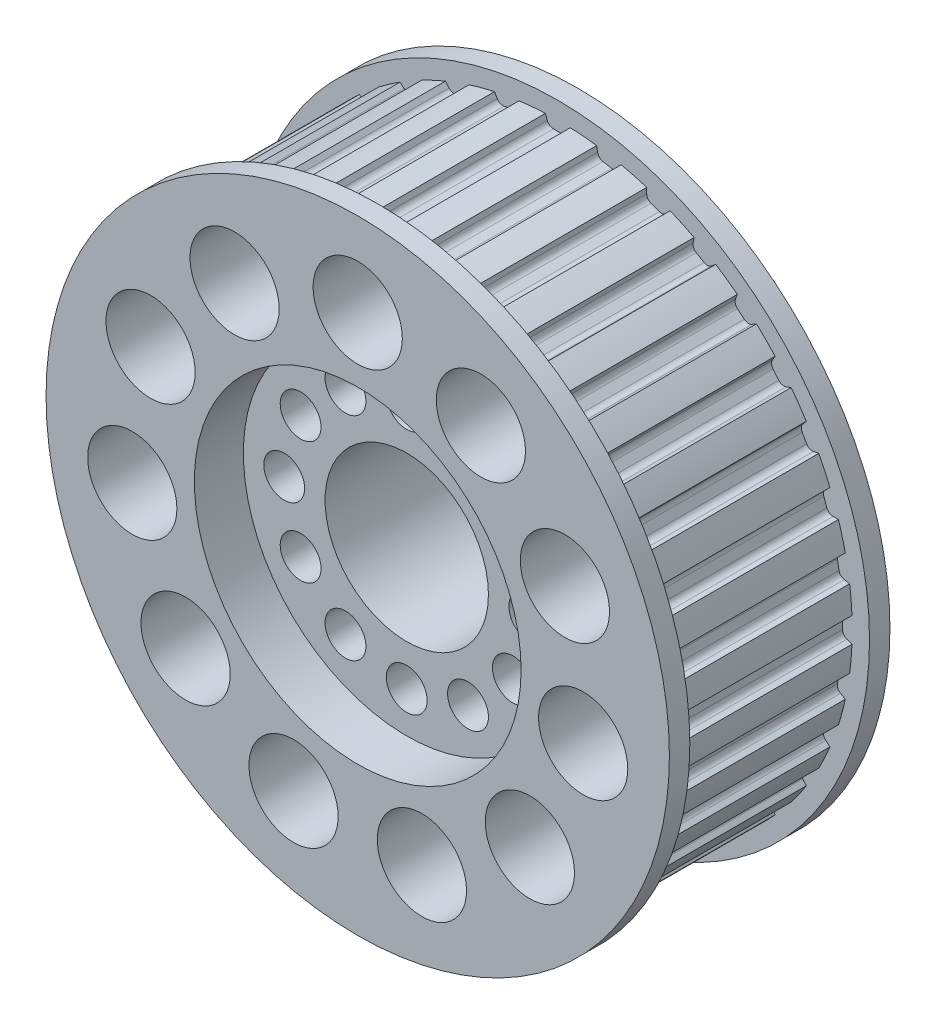
from build123d import *

# Parameters (mm, degrees)
SKETCH1_R                = 72.065639982
BASE_EXTRUDE_DEPTH       = 25
CUT_EXTRUDE1_DEPTH       = 105.937662123
FILLET1_R                = 1.6
CIRPATTERN1_COUNT        = 36
FILLET1_OF_CIRPATTERN1_R = 1.6
SKETCH7_R                = 40
CUT_EXTRUDE4_DEPTH       = 10
SKETCH12_R               = 75
SKETCH12_R_2             = 40
CUT_EXTRUDE7_DEPTH       = 3
CUT_EXTRUDE8_START       = -3
SKETCH13_R               = 75
SKETCH13_R_2             = 40
CUT_EXTRUDE8_DEPTH       = 3
SKETCH15_R               = 1.5
CUT_EXTRUDE10_DEPTH      = 60
CIRPATTERN2_COUNT        = 12
SKETCH16_R               = 5
CUT_EXTRUDE11_DEPTH      = 50
SKETCH17_R               = 13.5
CUT_EXTRUDE12_DEPTH      = 50
SKETCH19_R               = 10
CUT_EXTRUDE14_DEPTH      = 60
CIRPATTERN3_COUNT        = 12
CUT_EXTRUDE15_START      = -8
SKETCH20_R               = 40
CUT_EXTRUDE15_DEPTH      = 8
SKETCH24_R               = 16
CUT_EXTRUDE18_DEPTH      = 10
CUT_EXTRUDE19_START      = -10
SKETCH25_R               = 16
CUT_EXTRUDE19_DEPTH      = 10
SKETCH26_R               = 40
BOSS_EXTRUDE1_DEPTH      = 44
SKETCH27_R               = 10.92098708
CUT_EXTRUDE20_DEPTH      = 111.924785021
SKETCH28_R               = 20
CUT_EXTRUDE21_DEPTH      = 111.924785021
BOSS_EXTRUDE2_START      = 5
SKETCH30_R               = 76.309010231
SKETCH30_R_2             = 10.92098708
SKETCH30_R_3             = 40
BOSS_EXTRUDE2_DEPTH      = 5
SKETCH31_R               = 76.309010231
SKETCH31_R_2             = 40
SKETCH31_R_3             = 10.92098708
BOSS_EXTRUDE3_DEPTH      = 5


with BuildPart() as part:
    # Sketch1 → Base-Extrude (new, symmetric)
    with BuildSketch(Plane.XY):
        Circle(SKETCH1_R)
    extrude(amount=BASE_EXTRUDE_DEPTH, both=True)

    # Sketch2 → Cut-Extrude1 (cut, symmetric)
    with BuildSketch(Plane.XY):
        Polygon((-117.608490141, 386.747934069), (-3.05, 72.0010692), (-2.212868461, 69.7010692), (2.212868461, 69.7010692), (3.05, 72.0010692), (117.608490141, 386.747934069), (117.608490141, 1056.641169169), (-117.608490141, 1056.641169169), align=None)
    cut_extrude1 = extrude(amount=CUT_EXTRUDE1_DEPTH, both=True, mode=Mode.SUBTRACT)

    # Fillet1
    fillet1_edges = [part.edges().sort_by_distance(p)[0] for p in [
        (-2.212868461, 69.7010692, 0),
        (2.212868461, 69.7010692, 0),
    ]]
    fillet(fillet1_edges, radius=FILLET1_R)

    # CirPattern1: Cut-Extrude1 ×36 about axis
    cirpattern1_axis = Axis((0, 0, 0), (0, 0, 1))
    for i in range(1, CIRPATTERN1_COUNT):
        add(cut_extrude1.rotate(cirpattern1_axis, i * 360 / CIRPATTERN1_COUNT), mode=Mode.SUBTRACT)

    # Fillet1 of CirPattern1
    fillet1_of_cirpattern1_edges = [part.edges().sort_by_distance(p)[0] for p in [
        (-14.282713665, 68.257892766, 0),
        (-9.924213631, 69.026413917, 0),
        (-25.918585842, 64.7407348, 0),
        (-21.759753514, 66.254425976, 0),
        (-36.766934903, 59.256462368, 0),
        (-32.934134297, 61.469330829, 0),
        (-46.498139252, 51.971712311, 0),
        (-43.107828076, 54.816521169, 0),
        (-54.816521169, 43.107828076, 0),
        (-51.971712311, 46.498139252, 0),
        (-61.469330829, 32.934134297, 0),
        (-59.256462368, 36.766934903, 0),
        (-66.254425976, 21.759753514, 0),
        (-64.7407348, 25.918585842, 0),
        (-69.026413917, 9.924213631, 0),
        (-68.257892766, 14.282713665, 0),
        (-69.7010692, -2.212868461, 0),
        (-69.7010692, 2.212868461, 0),
        (-68.257892766, -14.282713665, 0),
        (-69.026413917, -9.924213631, 0),
        (-64.7407348, -25.918585842, 0),
        (-66.254425976, -21.759753514, 0),
        (-59.256462368, -36.766934903, 0),
        (-61.469330829, -32.934134297, 0),
        (-51.971712311, -46.498139252, 0),
        (-54.816521169, -43.107828076, 0),
        (-43.107828076, -54.816521169, 0),
        (-46.498139252, -51.971712311, 0),
        (-32.934134297, -61.469330829, 0),
        (-36.766934903, -59.256462368, 0),
        (-21.759753514, -66.254425976, 0),
        (-25.918585842, -64.7407348, 0),
        (-9.924213631, -69.026413917, 0),
        (-14.282713665, -68.257892766, 0),
        (2.212868461, -69.7010692, 0),
        (-2.212868461, -69.7010692, 0),
        (14.282713665, -68.257892766, 0),
        (9.924213631, -69.026413917, 0),
        (25.918585842, -64.7407348, 0),
        (21.759753514, -66.254425976, 0),
        (36.766934903, -59.256462368, 0),
        (32.934134297, -61.469330829, 0),
        (46.498139252, -51.971712311, 0),
        (43.107828076, -54.816521169, 0),
        (54.816521169, -43.107828076, 0),
        (51.971712311, -46.498139252, 0),
        (61.469330829, -32.934134297, 0),
        (59.256462368, -36.766934903, 0),
        (66.254425976, -21.759753514, 0),
        (64.7407348, -25.918585842, 0),
        (69.026413917, -9.924213631, 0),
        (68.257892766, -14.282713665, 0),
        (69.7010692, 2.212868461, 0),
        (69.7010692, -2.212868461, 0),
        (68.257892766, 14.282713665, 0),
        (69.026413917, 9.924213631, 0),
        (64.7407348, 25.918585842, 0),
        (66.254425976, 21.759753514, 0),
        (59.256462368, 36.766934903, 0),
        (61.469330829, 32.934134297, 0),
        (51.971712311, 46.498139252, 0),
        (54.816521169, 43.107828076, 0),
        (43.107828076, 54.816521169, 0),
        (46.498139252, 51.971712311, 0),
        (32.934134297, 61.469330829, 0),
        (36.766934903, 59.256462368, 0),
        (21.759753514, 66.254425976, 0),
        (25.918585842, 64.7407348, 0),
        (9.924213631, 69.026413917, 0),
        (14.282713665, 68.257892766, 0),
    ]]
    fillet(fillet1_of_cirpattern1_edges, radius=FILLET1_OF_CIRPATTERN1_R)

    # Sketch7 → Cut-Extrude4 (cut)
    with BuildSketch(Plane.XY.offset(25)):
        Circle(SKETCH7_R)
    extrude(amount=-CUT_EXTRUDE4_DEPTH, mode=Mode.SUBTRACT)

    # Sketch12 → Cut-Extrude7 (cut)
    with BuildSketch(Plane.XY.offset(25)):
        Circle(SKETCH12_R)
        Circle(SKETCH12_R_2, mode=Mode.SUBTRACT)
    extrude(amount=-CUT_EXTRUDE7_DEPTH, mode=Mode.SUBTRACT)

    # Sketch13 → Cut-Extrude8 (cut)
    with BuildSketch(Plane(origin=(0, 0, -25), x_dir=(-1, 0, 0), z_dir=(0, 0, -1)).offset(CUT_EXTRUDE8_START)):
        Circle(SKETCH13_R)
        with Locations(Location((0, 0, 0), (0, 0, 180))):
            Circle(SKETCH13_R_2, mode=Mode.SUBTRACT)
    extrude(amount=CUT_EXTRUDE8_DEPTH, mode=Mode.SUBTRACT)

    # Sketch15 → Cut-Extrude10 (cut)
    with BuildSketch(Plane.XY.offset(22)):
        with Locations((0, 60)):
            Circle(SKETCH15_R)
    cut_extrude10 = extrude(amount=-CUT_EXTRUDE10_DEPTH, mode=Mode.SUBTRACT)

    # CirPattern2: Cut-Extrude10 ×12 about axis
    cirpattern2_axis = Axis((0, 0, 0), (0, 0, 1))
    for i in range(1, CIRPATTERN2_COUNT):
        add(cut_extrude10.rotate(cirpattern2_axis, i * 360 / CIRPATTERN2_COUNT), mode=Mode.SUBTRACT)

    # Sketch16 → Cut-Extrude11 (cut)
    with BuildSketch(Plane(origin=(0, 0, -25), x_dir=(-1, 0, 0), z_dir=(0, 0, -1))):
        with Locations((0, 30)):
            Circle(SKETCH16_R)
        with Locations((15, 25.980762114)):
            Circle(SKETCH16_R)
        with Locations((25.980762114, 15)):
            Circle(SKETCH16_R)
        with Locations((30, 0)):
            Circle(SKETCH16_R)
        with Locations((25.980762114, -15)):
            Circle(SKETCH16_R)
        with Locations((15, -25.980762114)):
            Circle(SKETCH16_R)
        with Locations((0, -30)):
            Circle(SKETCH16_R)
        with Locations((-15, -25.980762114)):
            Circle(SKETCH16_R)
        with Locations((-25.980762114, -15)):
            Circle(SKETCH16_R)
        with Locations((-30, 0)):
            Circle(SKETCH16_R)
        with Locations((-25.980762114, 15)):
            Circle(SKETCH16_R)
        with Locations((-15, 25.980762114)):
            Circle(SKETCH16_R)
    extrude(amount=-CUT_EXTRUDE11_DEPTH, mode=Mode.SUBTRACT)

    # Sketch17 → Cut-Extrude12 (cut)
    with BuildSketch(Plane(origin=(0, 0, -25), x_dir=(-1, 0, 0), z_dir=(0, 0, -1))):
        Circle(SKETCH17_R)
    extrude(amount=-CUT_EXTRUDE12_DEPTH, mode=Mode.SUBTRACT)

    # Sketch19 → Cut-Extrude14 (cut)
    with BuildSketch(Plane.XY.offset(22)):
        with Locations((14.235047481, 53.125920446)):
            Circle(SKETCH19_R)
    cut_extrude14 = extrude(amount=-CUT_EXTRUDE14_DEPTH, mode=Mode.SUBTRACT)

    # CirPattern3: Cut-Extrude14 ×12 about axis
    cirpattern3_axis = Axis((0, 0, 0), (0, 0, 1))
    for i in range(1, CIRPATTERN3_COUNT):
        add(cut_extrude14.rotate(cirpattern3_axis, i * 360 / CIRPATTERN3_COUNT), mode=Mode.SUBTRACT)

    # Sketch20 → Cut-Extrude15 (cut)
    with BuildSketch(Plane(origin=(0, 0, -25), x_dir=(-1, 0, 0), z_dir=(0, 0, -1)).offset(CUT_EXTRUDE15_START)):
        with Locations(Location((0, 0, 0), (0, 0, 180))):
            Circle(SKETCH20_R)
    extrude(amount=CUT_EXTRUDE15_DEPTH, mode=Mode.SUBTRACT)

    # Sketch24 → Cut-Extrude18 (cut)
    with BuildSketch(Plane(origin=(0, 0, -17), x_dir=(-1, 0, 0), z_dir=(0, 0, -1))):
        Circle(SKETCH24_R)
    extrude(amount=-CUT_EXTRUDE18_DEPTH, mode=Mode.SUBTRACT)

    # Sketch25 → Cut-Extrude19 (cut)
    with BuildSketch(Plane.XY.offset(15).offset(CUT_EXTRUDE19_START)):
        with Locations(Location((0, 0, 0), (0, 0, 180))):
            Circle(SKETCH25_R)
    extrude(amount=CUT_EXTRUDE19_DEPTH, mode=Mode.SUBTRACT)

    # Sketch26 → Boss-Extrude1 (add, through all)
    with BuildSketch(Plane.XY.offset(22)):
        with BuildLine():
            Line((-13.179401965, -68.452436387), (-11.027525331, -68.831870296))
            ThreePointArc((-11.027525331, -68.831870296), (-10.173991565, -69.276191851), (-9.72967001, -70.129725617))
            Line((-9.72967001, -70.129725617), (-9.49919081, -71.436838115))
            ThreePointArc((-9.49919081, -71.436838115), (-6.280934379, -71.791408464), (-3.05, -72.0010692))
            Line((-3.05, -72.0010692), (-2.596044593, -70.753836971))
            ThreePointArc((-2.596044593, -70.753836971), (-2.010258698, -69.990425929), (-1.0925364, -69.7010692))
            Line((-1.0925364, -69.7010692), (1.0925364, -69.7010692))
            ThreePointArc((1.0925364, -69.7010692), (2.010258698, -69.990425929), (2.596044593, -70.753836971))
            Line((2.596044593, -70.753836971), (3.05, -72.0010692))
            ThreePointArc((3.05, -72.0010692), (6.280934379, -71.791408464), (9.49919081, -71.436838115))
            Line((9.49919081, -71.436838115), (9.72967001, -70.129725617))
            ThreePointArc((9.72967001, -70.129725617), (10.173991565, -69.276191851), (11.027525331, -68.831870296))
            Line((11.027525331, -68.831870296), (13.179401965, -68.452436387))
            ThreePointArc((13.179401965, -68.452436387), (14.133428268, -68.578036332), (14.842879696, -69.228128791))
            Line((14.842879696, -69.228128791), (15.506518103, -70.377584232))
            ThreePointArc((15.506518103, -70.377584232), (18.651960125, -69.610062846), (21.759753514, -68.702034853))
            Line((21.759753514, -68.702034853), (21.759753514, -67.374758038))
            ThreePointArc((21.759753514, -67.374758038), (22.049110243, -66.457035739), (22.812521285, -65.871249844))
            Line((22.812521285, -65.871249844), (24.865818071, -65.123910932))
            ThreePointArc((24.865818071, -65.123910932), (25.827160772, -65.081937803), (26.638721409, -65.59895895))
            Line((26.638721409, -65.59895895), (27.491878501, -66.615711979))
            ThreePointArc((27.491878501, -66.615711979), (30.4562555, -65.313650693), (33.359157119, -63.879755027))
            Line((33.359157119, -63.879755027), (33.128677918, -62.572642529))
            ThreePointArc((33.128677918, -62.572642529), (33.254277864, -61.618616226), (33.904370323, -60.909164798))
            Line((33.904370323, -60.909164798), (35.796698877, -59.816628398))
            ThreePointArc((35.796698877, -59.816628398), (36.736148065, -59.608357527), (37.625159053, -59.976597935))
            Line((37.625159053, -59.976597935), (38.641912082, -60.829755027))
            ThreePointArc((38.641912082, -60.829755027), (41.335152964, -59.032716314), (43.944959615, -57.116521169))
            Line((43.944959615, -57.116521169), (43.491004208, -55.86928894))
            ThreePointArc((43.491004208, -55.86928894), (43.449031079, -54.907946238), (43.966052226, -54.096385601))
            Line((43.966052226, -54.096385601), (45.639915102, -52.691847879))
            ThreePointArc((45.639915102, -52.691847879), (46.528926089, -52.323607471), (47.468375277, -52.531878342))
            Line((47.468375277, -52.531878342), (48.617830718, -53.19551675))
            ThreePointArc((48.617830718, -53.19551675), (50.958102722, -50.958102722), (53.19551675, -48.617830718))
            Line((53.19551675, -48.617830718), (52.531878342, -47.468375277))
            ThreePointArc((52.531878342, -47.468375277), (52.323607471, -46.528926089), (52.691847879, -45.639915102))
            Line((52.691847879, -45.639915102), (54.096385601, -43.966052226))
            ThreePointArc((54.096385601, -43.966052226), (54.907946238, -43.449031079), (55.86928894, -43.491004208))
            Line((55.86928894, -43.491004208), (57.116521169, -43.944959615))
            ThreePointArc((57.116521169, -43.944959615), (59.032716314, -41.335152964), (60.829755027, -38.641912082))
            Line((60.829755027, -38.641912082), (59.976597935, -37.625159053))
            ThreePointArc((59.976597935, -37.625159053), (59.608357527, -36.736148065), (59.816628398, -35.796698877))
            Line((59.816628398, -35.796698877), (60.909164798, -33.904370323))
            ThreePointArc((60.909164798, -33.904370323), (61.618616226, -33.254277864), (62.572642529, -33.128677918))
            Line((62.572642529, -33.128677918), (63.879755027, -33.359157119))
            ThreePointArc((63.879755027, -33.359157119), (65.313650693, -30.4562555), (66.615711979, -27.491878501))
            Line((66.615711979, -27.491878501), (65.59895895, -26.638721409))
            ThreePointArc((65.59895895, -26.638721409), (65.081937803, -25.827160772), (65.123910932, -24.865818071))
            Line((65.123910932, -24.865818071), (65.871249844, -22.812521285))
            ThreePointArc((65.871249844, -22.812521285), (66.457035739, -22.049110243), (67.374758038, -21.759753514))
            Line((67.374758038, -21.759753514), (68.702034853, -21.759753514))
            ThreePointArc((68.702034853, -21.759753514), (69.610062846, -18.651960125), (70.377584232, -15.506518103))
            Line((70.377584232, -15.506518103), (69.228128791, -14.842879696))
            ThreePointArc((69.228128791, -14.842879696), (68.578036332, -14.133428268), (68.452436387, -13.179401965))
            Line((68.452436387, -13.179401965), (68.831870296, -11.027525331))
            ThreePointArc((68.831870296, -11.027525331), (69.276191851, -10.173991565), (70.129725617, -9.72967001))
            Line((70.129725617, -9.72967001), (71.436838115, -9.49919081))
            ThreePointArc((71.436838115, -9.49919081), (71.791408464, -6.280934379), (72.0010692, -3.05))
            Line((72.0010692, -3.05), (70.753836971, -2.596044593))
            ThreePointArc((70.753836971, -2.596044593), (69.990425929, -2.010258698), (69.7010692, -1.0925364))
            Line((69.7010692, -1.0925364), (69.7010692, 1.0925364))
            ThreePointArc((69.7010692, 1.0925364), (69.990425929, 2.010258698), (70.753836971, 2.596044593))
            Line((70.753836971, 2.596044593), (72.0010692, 3.05))
            ThreePointArc((72.0010692, 3.05), (71.791408464, 6.280934379), (71.436838115, 9.49919081))
            Line((71.436838115, 9.49919081), (70.129725617, 9.72967001))
            ThreePointArc((70.129725617, 9.72967001), (69.276191851, 10.173991565), (68.831870296, 11.027525331))
            Line((68.831870296, 11.027525331), (68.452436387, 13.179401965))
            ThreePointArc((68.452436387, 13.179401965), (68.578036332, 14.133428268), (69.228128791, 14.842879696))
            Line((69.228128791, 14.842879696), (70.377584232, 15.506518103))
            ThreePointArc((70.377584232, 15.506518103), (69.610062846, 18.651960125), (68.702034853, 21.759753514))
            Line((68.702034853, 21.759753514), (67.374758038, 21.759753514))
            ThreePointArc((67.374758038, 21.759753514), (66.457035739, 22.049110243), (65.871249844, 22.812521285))
            Line((65.871249844, 22.812521285), (65.123910932, 24.865818071))
            ThreePointArc((65.123910932, 24.865818071), (65.081937803, 25.827160772), (65.59895895, 26.638721409))
            Line((65.59895895, 26.638721409), (66.615711979, 27.491878501))
            ThreePointArc((66.615711979, 27.491878501), (65.313650693, 30.4562555), (63.879755027, 33.359157119))
            Line((63.879755027, 33.359157119), (62.572642529, 33.128677918))
            ThreePointArc((62.572642529, 33.128677918), (61.618616226, 33.254277864), (60.909164798, 33.904370323))
            Line((60.909164798, 33.904370323), (59.816628398, 35.796698877))
            ThreePointArc((59.816628398, 35.796698877), (59.608357527, 36.736148065), (59.976597935, 37.625159053))
            Line((59.976597935, 37.625159053), (60.829755027, 38.641912082))
            ThreePointArc((60.829755027, 38.641912082), (59.032716314, 41.335152964), (57.116521169, 43.944959615))
            Line((57.116521169, 43.944959615), (55.86928894, 43.491004208))
            ThreePointArc((55.86928894, 43.491004208), (54.907946238, 43.449031079), (54.096385601, 43.966052226))
            Line((54.096385601, 43.966052226), (52.691847879, 45.639915102))
            ThreePointArc((52.691847879, 45.639915102), (52.323607471, 46.528926089), (52.531878342, 47.468375277))
            Line((52.531878342, 47.468375277), (53.19551675, 48.617830718))
            ThreePointArc((53.19551675, 48.617830718), (50.958102722, 50.958102722), (48.617830718, 53.19551675))
            Line((48.617830718, 53.19551675), (47.468375277, 52.531878342))
            ThreePointArc((47.468375277, 52.531878342), (46.528926089, 52.323607471), (45.639915102, 52.691847879))
            Line((45.639915102, 52.691847879), (43.966052226, 54.096385601))
            ThreePointArc((43.966052226, 54.096385601), (43.449031079, 54.907946238), (43.491004208, 55.86928894))
            Line((43.491004208, 55.86928894), (43.944959615, 57.116521169))
            ThreePointArc((43.944959615, 57.116521169), (41.335152964, 59.032716314), (38.641912082, 60.829755027))
            Line((38.641912082, 60.829755027), (37.625159053, 59.976597935))
            ThreePointArc((37.625159053, 59.976597935), (36.736148065, 59.608357527), (35.796698877, 59.816628398))
            Line((35.796698877, 59.816628398), (33.904370323, 60.909164798))
            ThreePointArc((33.904370323, 60.909164798), (33.254277864, 61.618616226), (33.128677918, 62.572642529))
            Line((33.128677918, 62.572642529), (33.359157119, 63.879755027))
            ThreePointArc((33.359157119, 63.879755027), (30.4562555, 65.313650693), (27.491878501, 66.615711979))
            Line((27.491878501, 66.615711979), (26.638721409, 65.59895895))
            ThreePointArc((26.638721409, 65.59895895), (25.827160772, 65.081937803), (24.865818071, 65.123910932))
            Line((24.865818071, 65.123910932), (22.812521285, 65.871249844))
            ThreePointArc((22.812521285, 65.871249844), (22.049110243, 66.457035739), (21.759753514, 67.374758038))
            Line((21.759753514, 67.374758038), (21.759753514, 68.702034853))
            ThreePointArc((21.759753514, 68.702034853), (18.651960125, 69.610062846), (15.506518103, 70.377584232))
            Line((15.506518103, 70.377584232), (14.842879696, 69.228128791))
            ThreePointArc((14.842879696, 69.228128791), (14.133428268, 68.578036332), (13.179401965, 68.452436387))
            Line((13.179401965, 68.452436387), (11.027525331, 68.831870296))
            ThreePointArc((11.027525331, 68.831870296), (10.173991565, 69.276191851), (9.72967001, 70.129725617))
            Line((9.72967001, 70.129725617), (9.49919081, 71.436838115))
            ThreePointArc((9.49919081, 71.436838115), (6.280934379, 71.791408464), (3.05, 72.0010692))
            Line((3.05, 72.0010692), (2.596044593, 70.753836971))
            ThreePointArc((2.596044593, 70.753836971), (2.010258698, 69.990425929), (1.0925364, 69.7010692))
            Line((1.0925364, 69.7010692), (-1.0925364, 69.7010692))
            ThreePointArc((-1.0925364, 69.7010692), (-2.010258698, 69.990425929), (-2.596044593, 70.753836971))
            Line((-2.596044593, 70.753836971), (-3.05, 72.0010692))
            ThreePointArc((-3.05, 72.0010692), (-6.280934379, 71.791408464), (-9.49919081, 71.436838115))
            Line((-9.49919081, 71.436838115), (-9.72967001, 70.129725617))
            ThreePointArc((-9.72967001, 70.129725617), (-10.173991565, 69.276191851), (-11.027525331, 68.831870296))
            Line((-11.027525331, 68.831870296), (-13.179401965, 68.452436387))
            ThreePointArc((-13.179401965, 68.452436387), (-14.133428268, 68.578036332), (-14.842879696, 69.228128791))
            Line((-14.842879696, 69.228128791), (-15.506518103, 70.377584232))
            ThreePointArc((-15.506518103, 70.377584232), (-18.651960125, 69.610062846), (-21.759753514, 68.702034853))
            Line((-21.759753514, 68.702034853), (-21.759753514, 67.374758038))
            ThreePointArc((-21.759753514, 67.374758038), (-22.049110243, 66.457035739), (-22.812521285, 65.871249844))
            Line((-22.812521285, 65.871249844), (-24.865818071, 65.123910932))
            ThreePointArc((-24.865818071, 65.123910932), (-25.827160772, 65.081937803), (-26.638721409, 65.59895895))
            Line((-26.638721409, 65.59895895), (-27.491878501, 66.615711979))
            ThreePointArc((-27.491878501, 66.615711979), (-30.4562555, 65.313650693), (-33.359157119, 63.879755027))
            Line((-33.359157119, 63.879755027), (-33.128677918, 62.572642529))
            ThreePointArc((-33.128677918, 62.572642529), (-33.254277864, 61.618616226), (-33.904370323, 60.909164798))
            Line((-33.904370323, 60.909164798), (-35.796698877, 59.816628398))
            ThreePointArc((-35.796698877, 59.816628398), (-36.736148065, 59.608357527), (-37.625159053, 59.976597935))
            Line((-37.625159053, 59.976597935), (-38.641912082, 60.829755027))
            ThreePointArc((-38.641912082, 60.829755027), (-41.335152964, 59.032716314), (-43.944959615, 57.116521169))
            Line((-43.944959615, 57.116521169), (-43.491004208, 55.86928894))
            ThreePointArc((-43.491004208, 55.86928894), (-43.449031079, 54.907946238), (-43.966052226, 54.096385601))
            Line((-43.966052226, 54.096385601), (-45.639915102, 52.691847879))
            ThreePointArc((-45.639915102, 52.691847879), (-46.528926089, 52.323607471), (-47.468375277, 52.531878342))
            Line((-47.468375277, 52.531878342), (-48.617830718, 53.19551675))
            ThreePointArc((-48.617830718, 53.19551675), (-50.958102722, 50.958102722), (-53.19551675, 48.617830718))
            Line((-53.19551675, 48.617830718), (-52.531878342, 47.468375277))
            ThreePointArc((-52.531878342, 47.468375277), (-52.323607471, 46.528926089), (-52.691847879, 45.639915102))
            Line((-52.691847879, 45.639915102), (-54.096385601, 43.966052226))
            ThreePointArc((-54.096385601, 43.966052226), (-54.907946238, 43.449031079), (-55.86928894, 43.491004208))
            Line((-55.86928894, 43.491004208), (-57.116521169, 43.944959615))
            ThreePointArc((-57.116521169, 43.944959615), (-59.032716314, 41.335152964), (-60.829755027, 38.641912082))
            Line((-60.829755027, 38.641912082), (-59.976597935, 37.625159053))
            ThreePointArc((-59.976597935, 37.625159053), (-59.608357527, 36.736148065), (-59.816628398, 35.796698877))
            Line((-59.816628398, 35.796698877), (-60.909164798, 33.904370323))
            ThreePointArc((-60.909164798, 33.904370323), (-61.618616226, 33.254277864), (-62.572642529, 33.128677918))
            Line((-62.572642529, 33.128677918), (-63.879755027, 33.359157119))
            ThreePointArc((-63.879755027, 33.359157119), (-65.313650693, 30.4562555), (-66.615711979, 27.491878501))
            Line((-66.615711979, 27.491878501), (-65.59895895, 26.638721409))
            ThreePointArc((-65.59895895, 26.638721409), (-65.081937803, 25.827160772), (-65.123910932, 24.865818071))
            Line((-65.123910932, 24.865818071), (-65.871249844, 22.812521285))
            ThreePointArc((-65.871249844, 22.812521285), (-66.457035739, 22.049110243), (-67.374758038, 21.759753514))
            Line((-67.374758038, 21.759753514), (-68.702034853, 21.759753514))
            ThreePointArc((-68.702034853, 21.759753514), (-69.610062846, 18.651960125), (-70.377584232, 15.506518103))
            Line((-70.377584232, 15.506518103), (-69.228128791, 14.842879696))
            ThreePointArc((-69.228128791, 14.842879696), (-68.578036332, 14.133428268), (-68.452436387, 13.179401965))
            Line((-68.452436387, 13.179401965), (-68.831870296, 11.027525331))
            ThreePointArc((-68.831870296, 11.027525331), (-69.276191851, 10.173991565), (-70.129725617, 9.72967001))
            Line((-70.129725617, 9.72967001), (-71.436838115, 9.49919081))
            ThreePointArc((-71.436838115, 9.49919081), (-71.791408464, 6.280934379), (-72.0010692, 3.05))
            Line((-72.0010692, 3.05), (-70.753836971, 2.596044593))
            ThreePointArc((-70.753836971, 2.596044593), (-69.990425929, 2.010258698), (-69.7010692, 1.0925364))
            Line((-69.7010692, 1.0925364), (-69.7010692, -1.0925364))
            ThreePointArc((-69.7010692, -1.0925364), (-69.990425929, -2.010258698), (-70.753836971, -2.596044593))
            Line((-70.753836971, -2.596044593), (-72.0010692, -3.05))
            ThreePointArc((-72.0010692, -3.05), (-71.791408464, -6.280934379), (-71.436838115, -9.49919081))
            Line((-71.436838115, -9.49919081), (-70.129725617, -9.72967001))
            ThreePointArc((-70.129725617, -9.72967001), (-69.276191851, -10.173991565), (-68.831870296, -11.027525331))
            Line((-68.831870296, -11.027525331), (-68.452436387, -13.179401965))
            ThreePointArc((-68.452436387, -13.179401965), (-68.578036332, -14.133428268), (-69.228128791, -14.842879696))
            Line((-69.228128791, -14.842879696), (-70.377584232, -15.506518103))
            ThreePointArc((-70.377584232, -15.506518103), (-69.610062846, -18.651960125), (-68.702034853, -21.759753514))
            Line((-68.702034853, -21.759753514), (-67.374758038, -21.759753514))
            ThreePointArc((-67.374758038, -21.759753514), (-66.457035739, -22.049110243), (-65.871249844, -22.812521285))
            Line((-65.871249844, -22.812521285), (-65.123910932, -24.865818071))
            ThreePointArc((-65.123910932, -24.865818071), (-65.081937803, -25.827160772), (-65.59895895, -26.638721409))
            Line((-65.59895895, -26.638721409), (-66.615711979, -27.491878501))
            ThreePointArc((-66.615711979, -27.491878501), (-65.313650693, -30.4562555), (-63.879755027, -33.359157119))
            Line((-63.879755027, -33.359157119), (-62.572642529, -33.128677918))
            ThreePointArc((-62.572642529, -33.128677918), (-61.618616226, -33.254277864), (-60.909164798, -33.904370323))
            Line((-60.909164798, -33.904370323), (-59.816628398, -35.796698877))
            ThreePointArc((-59.816628398, -35.796698877), (-59.608357527, -36.736148065), (-59.976597935, -37.625159053))
            Line((-59.976597935, -37.625159053), (-60.829755027, -38.641912082))
            ThreePointArc((-60.829755027, -38.641912082), (-59.032716314, -41.335152964), (-57.116521169, -43.944959615))
            Line((-57.116521169, -43.944959615), (-55.86928894, -43.491004208))
            ThreePointArc((-55.86928894, -43.491004208), (-54.907946238, -43.449031079), (-54.096385601, -43.966052226))
            Line((-54.096385601, -43.966052226), (-52.691847879, -45.639915102))
            ThreePointArc((-52.691847879, -45.639915102), (-52.323607471, -46.528926089), (-52.531878342, -47.468375277))
            Line((-52.531878342, -47.468375277), (-53.19551675, -48.617830718))
            ThreePointArc((-53.19551675, -48.617830718), (-50.958102722, -50.958102722), (-48.617830718, -53.19551675))
            Line((-48.617830718, -53.19551675), (-47.468375277, -52.531878342))
            ThreePointArc((-47.468375277, -52.531878342), (-46.528926089, -52.323607471), (-45.639915102, -52.691847879))
            Line((-45.639915102, -52.691847879), (-43.966052226, -54.096385601))
            ThreePointArc((-43.966052226, -54.096385601), (-43.449031079, -54.907946238), (-43.491004208, -55.86928894))
            Line((-43.491004208, -55.86928894), (-43.944959615, -57.116521169))
            ThreePointArc((-43.944959615, -57.116521169), (-41.335152964, -59.032716314), (-38.641912082, -60.829755027))
            Line((-38.641912082, -60.829755027), (-37.625159053, -59.976597935))
            ThreePointArc((-37.625159053, -59.976597935), (-36.736148065, -59.608357527), (-35.796698877, -59.816628398))
            Line((-35.796698877, -59.816628398), (-33.904370323, -60.909164798))
            ThreePointArc((-33.904370323, -60.909164798), (-33.254277864, -61.618616226), (-33.128677918, -62.572642529))
            Line((-33.128677918, -62.572642529), (-33.359157119, -63.879755027))
            ThreePointArc((-33.359157119, -63.879755027), (-30.4562555, -65.313650693), (-27.491878501, -66.615711979))
            Line((-27.491878501, -66.615711979), (-26.638721409, -65.59895895))
            ThreePointArc((-26.638721409, -65.59895895), (-25.827160772, -65.081937803), (-24.865818071, -65.123910932))
            Line((-24.865818071, -65.123910932), (-22.812521285, -65.871249844))
            ThreePointArc((-22.812521285, -65.871249844), (-22.049110243, -66.457035739), (-21.759753514, -67.374758038))
            Line((-21.759753514, -67.374758038), (-21.759753514, -68.702034853))
            ThreePointArc((-21.759753514, -68.702034853), (-18.651960125, -69.610062846), (-15.506518103, -70.377584232))
            Line((-15.506518103, -70.377584232), (-14.842879696, -69.228128791))
            ThreePointArc((-14.842879696, -69.228128791), (-14.133428268, -68.578036332), (-13.179401965, -68.452436387))
        make_face()
        Circle(SKETCH26_R, mode=Mode.SUBTRACT)
    extrude(amount=-BOSS_EXTRUDE1_DEPTH)

    # Sketch27 → Cut-Extrude20 (cut, through all)
    with BuildSketch(Plane.XY.offset(22)):
        with Locations((30.14877216, 46.912405188)):
            Circle(SKETCH27_R)
        with Locations((0, 55.764883424)):
            Circle(SKETCH27_R)
        with Locations((-30.14877216, 46.912405188)):
            Circle(SKETCH27_R)
        with Locations((-50.725522179, 23.165569773)):
            Circle(SKETCH27_R)
        with Locations((-55.197277317, -7.936170366)):
            Circle(SKETCH27_R)
        with Locations((-42.144286911, -36.518232487)):
            Circle(SKETCH27_R)
        with Locations((-15.710783189, -53.506013819)):
            Circle(SKETCH27_R)
        with Locations((15.710783189, -53.506013819)):
            Circle(SKETCH27_R)
        with Locations((42.144286912, -36.518232487)):
            Circle(SKETCH27_R)
        with Locations((55.197277317, -7.936170366)):
            Circle(SKETCH27_R)
        with Locations((50.72552218, 23.165569773)):
            Circle(SKETCH27_R)
    extrude(amount=-CUT_EXTRUDE20_DEPTH, mode=Mode.SUBTRACT)

    # Sketch28 → Cut-Extrude21 (cut, through all)
    with BuildSketch(Plane.XY.offset(22)):
        Circle(SKETCH28_R)
    extrude(amount=-CUT_EXTRUDE21_DEPTH, mode=Mode.SUBTRACT)

    # Sketch30 → Boss-Extrude2 (add)
    with BuildSketch(Plane.XY.offset(22).offset(BOSS_EXTRUDE2_START)):
        Circle(SKETCH30_R)
        with Locations((55.197277317, -7.936170366)):
            Circle(SKETCH30_R_2, mode=Mode.SUBTRACT)
        with Locations((50.72552218, 23.165569773)):
            Circle(SKETCH30_R_2, mode=Mode.SUBTRACT)
        with Locations((30.14877216, 46.912405188)):
            Circle(SKETCH30_R_2, mode=Mode.SUBTRACT)
        with Locations((0, 55.764883424)):
            Circle(SKETCH30_R_2, mode=Mode.SUBTRACT)
        with Locations((-30.14877216, 46.912405188)):
            Circle(SKETCH30_R_2, mode=Mode.SUBTRACT)
        with Locations((-50.725522179, 23.165569773)):
            Circle(SKETCH30_R_2, mode=Mode.SUBTRACT)
        with Locations((-55.197277317, -7.936170366)):
            Circle(SKETCH30_R_2, mode=Mode.SUBTRACT)
        with Locations((-42.144286911, -36.518232487)):
            Circle(SKETCH30_R_2, mode=Mode.SUBTRACT)
        with Locations((-15.710783189, -53.506013819)):
            Circle(SKETCH30_R_2, mode=Mode.SUBTRACT)
        with Locations((15.710783189, -53.506013819)):
            Circle(SKETCH30_R_2, mode=Mode.SUBTRACT)
        with Locations((42.144286912, -36.518232487)):
            Circle(SKETCH30_R_2, mode=Mode.SUBTRACT)
        Circle(SKETCH30_R_3, mode=Mode.SUBTRACT)
    extrude(amount=-BOSS_EXTRUDE2_DEPTH)

    # Sketch31 → Boss-Extrude3 (add)
    with BuildSketch(Plane(origin=(0, 0, -22), x_dir=(-1, 0, 0), z_dir=(0, 0, -1))):
        with Locations(Location((0, 0, 0), (0, 0, 180))):
            Circle(SKETCH31_R)
        with Locations(Location((0, 0, 0), (0, 0, 180))):
            Circle(SKETCH31_R_2, mode=Mode.SUBTRACT)
        with Locations(Location((-50.72552218, 23.165569773, 0), (0, 0, 180))):
            Circle(SKETCH31_R_3, mode=Mode.SUBTRACT)
        with Locations(Location((-30.14877216, 46.912405188, 0), (0, 0, 180))):
            Circle(SKETCH31_R_3, mode=Mode.SUBTRACT)
        with Locations(Location((0, 55.764883424, 0), (0, 0, 180))):
            Circle(SKETCH31_R_3, mode=Mode.SUBTRACT)
        with Locations(Location((30.14877216, 46.912405188, 0), (0, 0, 180))):
            Circle(SKETCH31_R_3, mode=Mode.SUBTRACT)
        with Locations(Location((50.725522179, 23.165569773, 0), (0, 0, 180))):
            Circle(SKETCH31_R_3, mode=Mode.SUBTRACT)
        with Locations(Location((55.197277317, -7.936170366, 0), (0, 0, 180))):
            Circle(SKETCH31_R_3, mode=Mode.SUBTRACT)
        with Locations(Location((42.144286911, -36.518232487, 0), (0, 0, 180))):
            Circle(SKETCH31_R_3, mode=Mode.SUBTRACT)
        with Locations(Location((15.710783189, -53.506013819, 0), (0, 0, 180))):
            Circle(SKETCH31_R_3, mode=Mode.SUBTRACT)
        with Locations(Location((-15.710783189, -53.506013819, 0), (0, 0, 180))):
            Circle(SKETCH31_R_3, mode=Mode.SUBTRACT)
        with Locations(Location((-42.144286912, -36.518232487, 0), (0, 0, 180))):
            Circle(SKETCH31_R_3, mode=Mode.SUBTRACT)
        with Locations(Location((-55.197277317, -7.936170366, 0), (0, 0, 180))):
            Circle(SKETCH31_R_3, mode=Mode.SUBTRACT)
    extrude(amount=BOSS_EXTRUDE3_DEPTH)


solid = part.part
